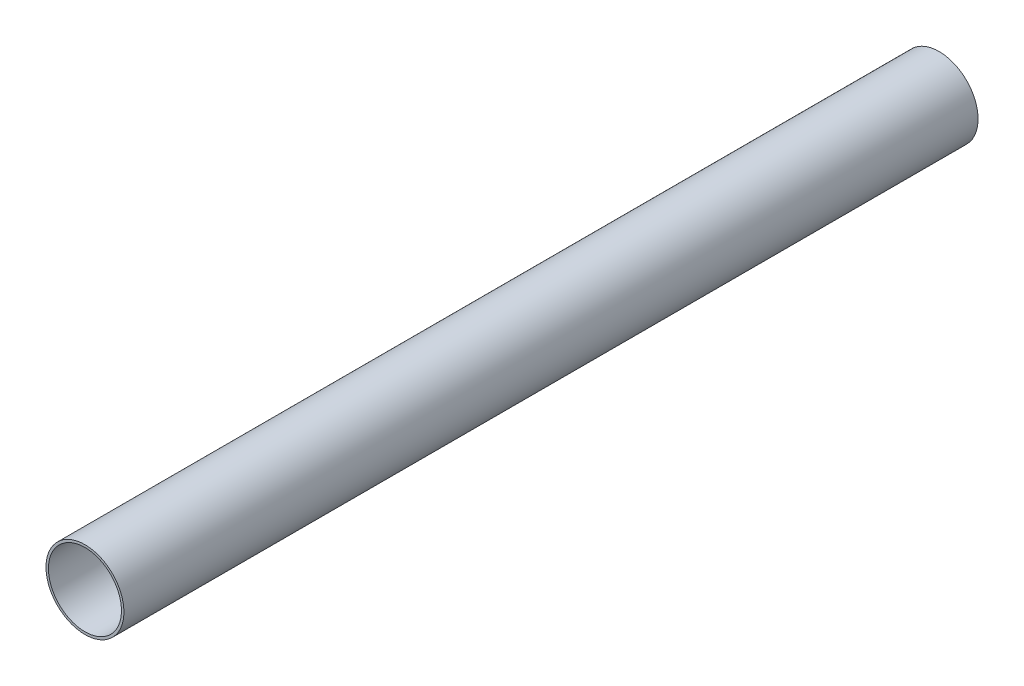
from build123d import *

# Parameters (mm, degrees)
SKETCH1_R           = 25.4
SKETCH1_R_2         = 23.8125
BOSS_EXTRUDE1_DEPTH = 278.425000045


with BuildPart() as part:
    # Sketch1 → Boss-Extrude1 (new, symmetric)
    with BuildSketch(Plane.XY):
        Circle(SKETCH1_R)
        Circle(SKETCH1_R_2, mode=Mode.SUBTRACT)
    extrude(amount=BOSS_EXTRUDE1_DEPTH, both=True)


solid = part.part
